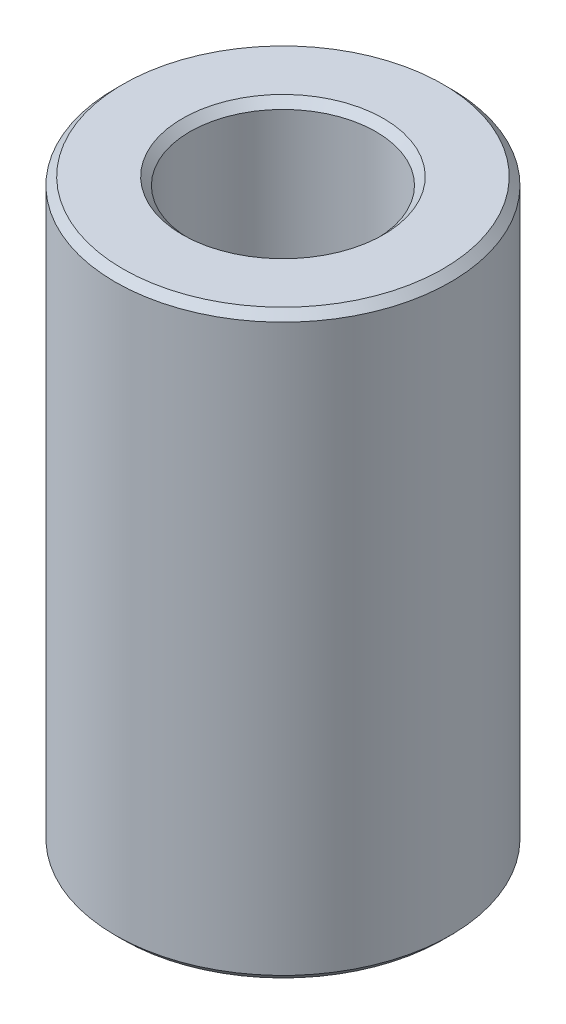
from build123d import *

# Parameters (mm, degrees)
SKETCH1_R           = 27.5
BOSS_EXTRUDE1_DEPTH = 95.308078927
SKETCH2_R           = 15.264723887
CUT_EXTRUDE1_DEPTH  = 103.93750487
CHAMFER1_SIZE       = 1.247081607


with BuildPart() as part:
    # Sketch1 → Boss-Extrude1 (new body)
    with BuildSketch(Plane(origin=(0, 0, 0), x_dir=(1, 0, 0), z_dir=(0, 1, 0))):
        Circle(SKETCH1_R)
    extrude(amount=BOSS_EXTRUDE1_DEPTH)

    # Sketch2 → Cut-Extrude1 (cut, through all)
    with BuildSketch(Plane(origin=(0, 0, 0), x_dir=(1, 0, 0), z_dir=(0, 1, 0))):
        Circle(SKETCH2_R)
    extrude(amount=CUT_EXTRUDE1_DEPTH, mode=Mode.SUBTRACT)

    # Chamfer1
    chamfer1_edges = [part.edges().sort_by_distance(p)[0] for p in [
        (-15.264723887, 95.308078927, 0),
        (-15.264723887, 0, 0),
        (-27.5, 0, 0),
        (-27.5, 95.308078927, 0),
    ]]
    chamfer(chamfer1_edges, length=CHAMFER1_SIZE)


solid = part.part
